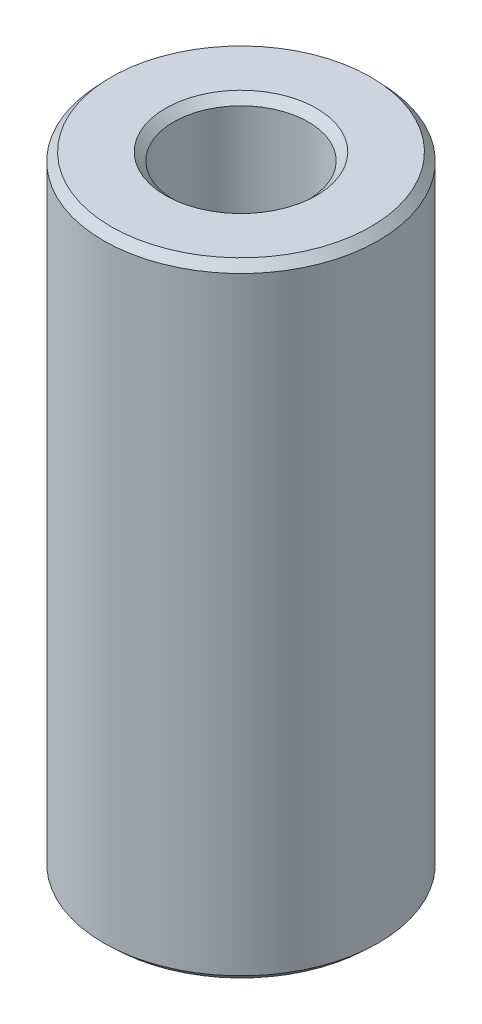
from build123d import *
from OCP.BRepFilletAPI import BRepFilletAPI_MakeChamfer

# Parameters (mm, degrees)
SKETCH1_R           = 22.5
BOSS_EXTRUDE1_DEPTH = 102.198678211
SKETCH2_R           = 11.026312172
CUT_EXTRUDE1_DEPTH  = 108.037702835
CHAMFER1_SIZE       = 1.344210957
CHAMFER1_SIZE2      = 1.258218605


with BuildPart() as part:
    # Sketch1 → Boss-Extrude1 (new body)
    with BuildSketch(Plane(origin=(0, 0, 0), x_dir=(1, 0, 0), z_dir=(0, 1, 0))):
        Circle(SKETCH1_R)
    extrude(amount=BOSS_EXTRUDE1_DEPTH)

    # Sketch2 → Cut-Extrude1 (cut, through all)
    with BuildSketch(Plane(origin=(0, 0, 0), x_dir=(1, 0, 0), z_dir=(0, 1, 0))):
        Circle(SKETCH2_R)
    extrude(amount=CUT_EXTRUDE1_DEPTH, mode=Mode.SUBTRACT)

    # Chamfer1: one chamfer whose edges measure the first distance from different faces: ONE call of the kernel's chamfer builder (chamfer() names one face for all edges)
    chamfer1_edges_1 = [part.edges().sort_by_distance(p)[0] for p in [
        (-11.026312172, 102.198678211, 0),
    ]]
    chamfer1_side_1 = [part.faces().sort_by_distance(p)[0] for p in [
        (-21.863603897, 102.198678211, 0),
    ]]
    chamfer1_edges_2 = [part.edges().sort_by_distance(p)[0] for p in [
        (-11.026312172, 0, 0),
    ]]
    chamfer1_side_2 = [part.faces().sort_by_distance(p)[0] for p in [
        (-11.026312172, 51.099339106, 0),
    ]]
    chamfer1_edges_3 = [part.edges().sort_by_distance(p)[0] for p in [
        (-22.5, 0, 0),
    ]]
    chamfer1_side_3 = [part.faces().sort_by_distance(p)[0] for p in [
        (-21.863603897, 0, 0),
    ]]
    chamfer1_edges_4 = [part.edges().sort_by_distance(p)[0] for p in [
        (-22.5, 102.198678211, 0),
    ]]
    chamfer1_side_4 = [part.faces().sort_by_distance(p)[0] for p in [
        (-22.5, 51.099339106, 0),
    ]]
    chamfer1 = BRepFilletAPI_MakeChamfer(part.part.solid().wrapped)
    for e in chamfer1_edges_1:
        chamfer1.Add(CHAMFER1_SIZE, CHAMFER1_SIZE2, e.wrapped, chamfer1_side_1[0].wrapped)  # the first distance lies on this face
    for e in chamfer1_edges_2:
        chamfer1.Add(CHAMFER1_SIZE, CHAMFER1_SIZE2, e.wrapped, chamfer1_side_2[0].wrapped)  # the first distance lies on this face
    for e in chamfer1_edges_3:
        chamfer1.Add(CHAMFER1_SIZE, CHAMFER1_SIZE2, e.wrapped, chamfer1_side_3[0].wrapped)  # the first distance lies on this face
    for e in chamfer1_edges_4:
        chamfer1.Add(CHAMFER1_SIZE, CHAMFER1_SIZE2, e.wrapped, chamfer1_side_4[0].wrapped)  # the first distance lies on this face
    add(Compound.cast(chamfer1.Shape()), mode=Mode.REPLACE)


solid = part.part
